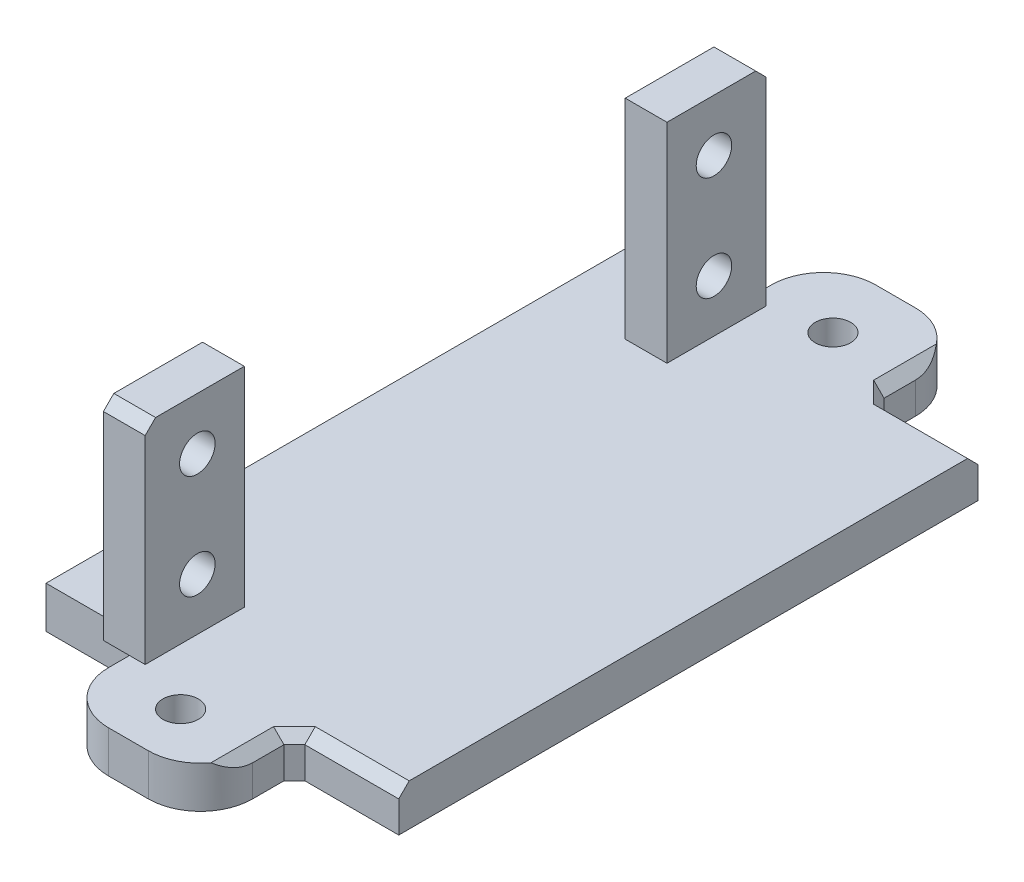
from build123d import *

# Parameters (mm, degrees)
SKETCH1_W           = 33.8
SKETCH1_H           = 55.5
BOSS_EXTRUDE1_DEPTH = 4
SKETCH3_W           = 4
SKETCH3_H           = 7.5
BOSS_EXTRUDE2_DEPTH = 20
SKETCH4_R           = 1.7
CUT_EXTRUDE1_DEPTH  = 20
SKETCH5_W           = 4
SKETCH5_H           = 20
BOSS_EXTRUDE3_DEPTH = 2
SKETCH6_W           = 4
SKETCH6_H           = 20
BOSS_EXTRUDE4_DEPTH = 2
CHAMFER1_SIZE       = 2
CHAMFER3_SIZE       = 1
SKETCH7_W           = 13.8
SKETCH7_H           = 9
BOSS_EXTRUDE5_DEPTH = 4
CHAMFER4_SIZE       = 1
FILLET1_R           = 5
SKETCH8_R           = 1.7
CUT_EXTRUDE2_DEPTH  = 4


with BuildPart() as part:
    # Sketch1 → Boss-Extrude1 (new body)
    with BuildSketch(Plane(origin=(0, 0, 0), x_dir=(1, 0, 0), z_dir=(0, 1, 0))):
        with Locations((16.9, 27.75)):
            Rectangle(SKETCH1_W, SKETCH1_H)
    extrude(amount=BOSS_EXTRUDE1_DEPTH)

    # Sketch3 → Boss-Extrude2 (add)
    with BuildSketch(Plane(origin=(0, 4, 0), x_dir=(1, 0, 0), z_dir=(0, 1, 0))):
        with Locations((9.5, 3.75)):
            Rectangle(SKETCH3_W, SKETCH3_H)
        with Locations((9.5, 51.75)):
            Rectangle(SKETCH3_W, SKETCH3_H)
    extrude(amount=BOSS_EXTRUDE2_DEPTH)

    # Sketch4 → Cut-Extrude1 (cut)
    with BuildSketch(Plane.ZY.offset(-7.5)):
        with Locations((-3, 19)):
            Circle(SKETCH4_R)
        with Locations((-3, 9)):
            Circle(SKETCH4_R)
        with Locations((-52.5, 9)):
            Circle(SKETCH4_R)
        with Locations((-52.5, 19)):
            Circle(SKETCH4_R)
    extrude(amount=-CUT_EXTRUDE1_DEPTH, mode=Mode.SUBTRACT)

    # Sketch5 → Boss-Extrude3 (add)
    with BuildSketch(Plane.XY):
        with Locations((9.5, 14)):
            Rectangle(SKETCH5_W, SKETCH5_H)
    extrude(amount=BOSS_EXTRUDE3_DEPTH)

    # Sketch6 → Boss-Extrude4 (add)
    with BuildSketch(Plane(origin=(0, 0, -55.5), x_dir=(-1, 0, 0), z_dir=(0, 0, -1))):
        with Locations((-9.5, 14)):
            Rectangle(SKETCH6_W, SKETCH6_H)
    extrude(amount=BOSS_EXTRUDE4_DEPTH)

    # Chamfer1
    chamfer1_edges = [part.edges().sort_by_distance(p)[0] for p in [
        (9.5, 4, 0),
        (9.5, 4, -55.5),
    ]]
    chamfer(chamfer1_edges, length=CHAMFER1_SIZE - 0.0001)  # a hair under: the kernel refuses the full size

    # Chamfer3
    chamfer3_edges = [part.edges().sort_by_distance(p)[0] for p in [
        (9.5, 24, 2),
        (9.5, 24, -57.5),
    ]]
    chamfer(chamfer3_edges, length=CHAMFER3_SIZE)

    # Sketch7 → Boss-Extrude5 (add)
    with BuildSketch(Plane.XZ):
        with Locations((16.9, 4.5)):
            Rectangle(SKETCH7_W, SKETCH7_H)
        with Locations((16.9, -60)):
            Rectangle(SKETCH7_W, SKETCH7_H)
    extrude(amount=-BOSS_EXTRUDE5_DEPTH)

    # Chamfer4
    chamfer4_edges = [part.edges().sort_by_distance(p)[0] for p in [
        (28.8, 4, 0),
        (23.8, 2, 0),
        (10, 1.00005, 0),
        (23.8, 4, 4.5),
        (10, 1.00005, -55.5),
        (23.8, 4, -60),
        (23.8, 2, -55.5),
        (28.8, 4, -55.5),
    ]]
    chamfer(chamfer4_edges, length=CHAMFER4_SIZE)

    # Fillet1
    fillet1_edges = [part.edges().sort_by_distance(p)[0] for p in [
        (10, 2, -64.5),
        (23.8, 1.5, -64.5),
        (10, 2, 9),
        (23.8, 1.5, 9),
    ]]
    fillet(fillet1_edges, radius=FILLET1_R)

    # Sketch8 → Cut-Extrude2 (cut)
    with BuildSketch(Plane(origin=(0, 4, 0), x_dir=(1, 0, 0), z_dir=(0, 1, 0))):
        with Locations(Location((16.9, 58.5, 0), (0, 0, 270))):
            Circle(SKETCH8_R)
        with Locations(Location((16.9, -4, 0), (0, 0, 270))):
            Circle(SKETCH8_R)
    extrude(amount=-CUT_EXTRUDE2_DEPTH, mode=Mode.SUBTRACT)


solid = part.part
